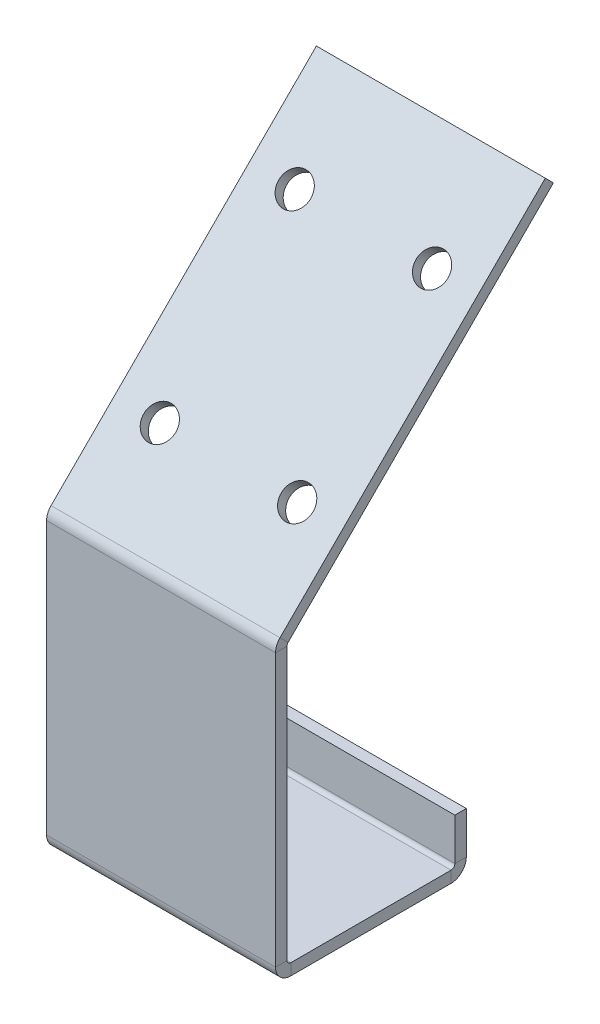
from build123d import *

# Parameters (mm, degrees)
SKETCH1_W                    = 60
SKETCH1_H                    = 80
BASE_FLANGE1_DEPTH           = 3
EDGE_FLANGE1_START           = -30
EDGE_FLANGE1_DEPTH           = 60
EDGE_FLANGE1_2_DEPTH         = 60
EDGE_FLANGE2_STRIP_W         = 14
EDGE_FLANGE2_STRIP_H         = 3
EDGE_FLANGE2_STRIP_CUT_DEPTH = 60
EDGE_FLANGE2_DEPTH           = 60
EDGE_FLANGE3_STRIP_W         = 14
EDGE_FLANGE3_STRIP_H         = 3
EDGE_FLANGE3_STRIP_CUT_DEPTH = 60
EDGE_FLANGE3_DEPTH           = 60
SKETCH17_R                   = 4.2
CUT_EXTRUDE1_DEPTH           = 10
SKETCH18_R                   = 4.2
CUT_EXTRUDE2_DEPTH           = 10


# Read off the part's stored shape, not the designer's step: Edge-Flange1
# Sheet-metal steps are written as plain solids
with BuildPart() as part:
    # Sketch1 → Base-Flange1 (new body)
    with BuildSketch(Plane.XY):
        Rectangle(SKETCH1_W, SKETCH1_H)
    extrude(amount=-BASE_FLANGE1_DEPTH)

    # Edge-Flange1 outline → Edge-Flange1 (cut)
    with BuildSketch(Plane.YZ.offset(EDGE_FLANGE1_START)):
        with BuildLine():
            ThreePointArc((35.343145751, 0), (36.87387948, -0.30448187), (38.171572875, -1.171572875))
            Line((38.171572875, -1.171572875), (40, -3))
            Line((40, -3), (40, 0))
            Line((40, 0), (35.343145751, 0))
        make_face()
    extrude(amount=EDGE_FLANGE1_DEPTH, mode=Mode.SUBTRACT)

    # Edge-Flange1 2 outline → Edge-Flange1 2 (add)
    with BuildSketch(Plane.YZ.offset(EDGE_FLANGE1_START)):
        with BuildLine():
            Line((107.710678119, -70.710678119), (40, -3))
            Line((40, -3), (35.343145751, -3))
            ThreePointArc((35.343145751, -3), (35.725829183, -3.076120467), (36.050252532, -3.292893219))
            Line((36.050252532, -3.292893219), (105.589357775, -72.831998462))
            Line((105.589357775, -72.831998462), (107.710678119, -70.710678119))
        make_face()
    extrude(amount=EDGE_FLANGE1_2_DEPTH)

    # Edge-Flange2 strip (across the edge) → Edge-Flange2 strip cut (cut)
    with BuildSketch(Plane(origin=(30, -40, -3), x_dir=(0, 1, 0), z_dir=(-1, 0, 0))):
        with Locations((-3, -1.5)):
            Rectangle(EDGE_FLANGE2_STRIP_W, EDGE_FLANGE2_STRIP_H)
    extrude(amount=EDGE_FLANGE2_STRIP_CUT_DEPTH, mode=Mode.SUBTRACT)

    # Edge-Flange2 section (across the edge) → Edge-Flange2 (add)
    with BuildSketch(Plane(origin=(30, -40, -3), x_dir=(0, 1, 0), z_dir=(-1, 0, 0))):
        with BuildLine():
            Line((0, 1), (0, 47))
            Line((0, 47), (3, 47))
            Line((3, 47), (3, 1))
            ThreePointArc((3, 1), (3.292893219, 0.292893219), (4, 0))
            Line((4, 0), (4, -3))
            ThreePointArc((4, -3), (1.171572875, -1.828427125), (0, 1))
        make_face()
    extrude(amount=EDGE_FLANGE2_DEPTH)

    # Edge-Flange3 strip (across the edge) → Edge-Flange3 strip cut (cut)
    with BuildSketch(Plane(origin=(30, -37, -50), x_dir=(0, 0, 1), z_dir=(-1, 0, 0))):
        with Locations((-3, -1.5)):
            Rectangle(EDGE_FLANGE3_STRIP_W, EDGE_FLANGE3_STRIP_H)
    extrude(amount=EDGE_FLANGE3_STRIP_CUT_DEPTH, mode=Mode.SUBTRACT)

    # Edge-Flange3 section (across the edge) → Edge-Flange3 (add)
    with BuildSketch(Plane(origin=(30, -37, -50), x_dir=(0, 0, 1), z_dir=(-1, 0, 0))):
        with BuildLine():
            Line((0, 1), (0, 12))
            Line((0, 12), (3, 12))
            Line((3, 12), (3, 1))
            ThreePointArc((3, 1), (3.292893219, 0.292893219), (4, 0))
            Line((4, 0), (4, -3))
            ThreePointArc((4, -3), (1.171572875, -1.828427125), (0, 1))
        make_face()
    extrude(amount=EDGE_FLANGE3_DEPTH)

    # Sketch17 → Cut-Extrude1 (cut)
    with BuildSketch(Plane.XZ.offset(40)):
        with Locations(Location((0, -25, 0), (0, 0, 270))):
            Circle(SKETCH17_R)
    extrude(amount=-CUT_EXTRUDE1_DEPTH, mode=Mode.SUBTRACT)

    # Sketch18 → Cut-Extrude2 (cut)
    with BuildSketch(Plane(origin=(0, 18.5, 18.5), x_dir=(1, 0, 0), z_dir=(0, 0.7071067811865438, 0.7071067811865513))):
        with Locations(Location((-18, 101.162950904, 0), (0, 0, 270))):
            Circle(SKETCH18_R)
        with Locations(Location((18, 101.162950904, 0), (0, 0, 270))):
            Circle(SKETCH18_R)
        with Locations(Location((18, 51.162950904, 0), (0, 0, 270))):
            Circle(SKETCH18_R)
        with Locations(Location((-18, 51.162950904, 0), (0, 0, 270))):
            Circle(SKETCH18_R)
    extrude(amount=-CUT_EXTRUDE2_DEPTH, mode=Mode.SUBTRACT)


solid = part.part
